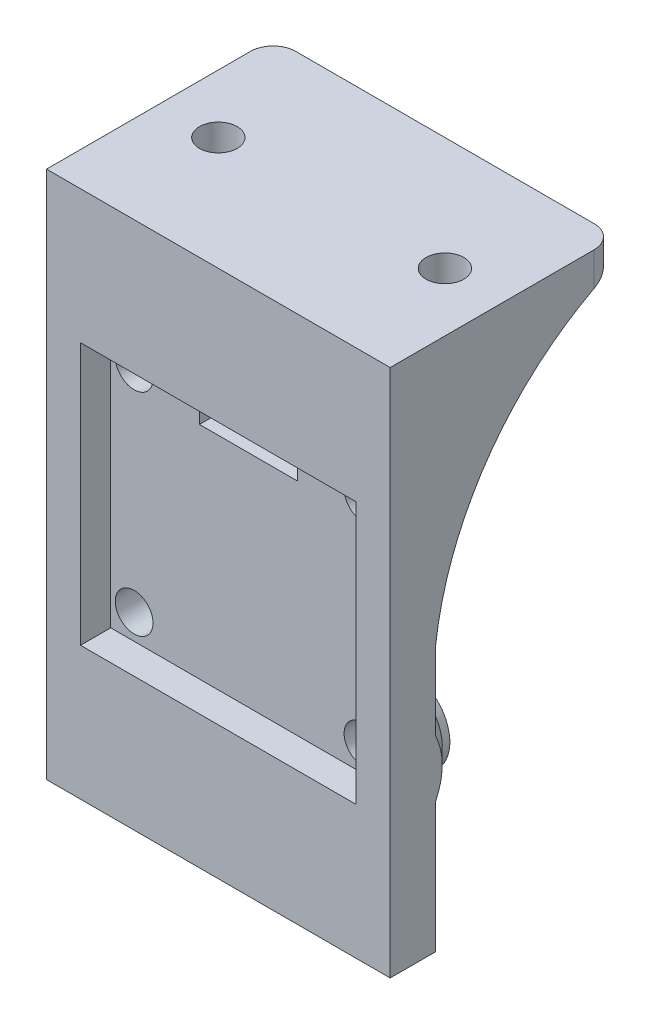
from build123d import *

# Parameters (mm, degrees)
SKETCH1_W                = 45.5
SKETCH1_H                = 70
SKETCH1_R                = 2.5
BOSS_EXTRUDE1_DEPTH      = 6
SKETCH2_W                = 36.5
SKETCH2_H                = 34.7
CUT_EXTRUDE1_DEPTH       = 4
BOSS_EXTRUDE2_DEPTH      = 22.75
BOSS_EXTRUDE2_DEPTH_BACK = 22.75
SKETCH3_W                = 24
SKETCH3_H                = 3
BOSS_EXTRUDE3_DEPTH      = 2
BOSS_EXTRUDE4_START      = -2
BOSS_EXTRUDE4_DEPTH      = 2
SKETCH6_R                = 2.5
CUT_EXTRUDE2_DEPTH       = 6
FILLET1_R                = 3
SKETCH7_R                = 5.5
SKETCH7_R_2              = 2.5
BOSS_EXTRUDE5_DEPTH      = 3
BOSS_EXTRUDE6_START      = 4
SKETCH8_R                = 5.5
SKETCH8_R_2              = 2.5
BOSS_EXTRUDE6_DEPTH      = 4
CHAMFER1_SIZE            = 3
SKETCH10_W               = 13
SKETCH10_H               = 5.5
CUT_EXTRUDE3_DEPTH       = 10
CHAMFER3_SIZE            = 1


with BuildPart() as part:
    # Sketch1 → Boss-Extrude1 (new body)
    with BuildSketch(Plane.XY):
        Rectangle(SKETCH1_W, SKETCH1_H)
        with Locations((-15.15, 14)):
            Circle(SKETCH1_R, mode=Mode.SUBTRACT)
        with Locations((15.15, 14)):
            Circle(SKETCH1_R, mode=Mode.SUBTRACT)
        with Locations((15.15, -14)):
            Circle(SKETCH1_R, mode=Mode.SUBTRACT)
        with Locations((-15.15, -14)):
            Circle(SKETCH1_R, mode=Mode.SUBTRACT)
    extrude(amount=BOSS_EXTRUDE1_DEPTH)

    # Sketch2 → Cut-Extrude1 (cut)
    with BuildSketch(Plane.XY.offset(6)):
        Rectangle(SKETCH2_W, SKETCH2_H)
    extrude(amount=-CUT_EXTRUDE1_DEPTH, mode=Mode.SUBTRACT)

    # Sketch3 → Boss-Extrude2 (add, two sides: drawn at the far end of the back side and taken through both)
    with BuildSketch(Plane(origin=(0, 0, 0), x_dir=(0, 0, -1), z_dir=(1, 0, 0)).offset(-BOSS_EXTRUDE2_DEPTH_BACK)):
        with Locations((12, 33.5)):
            Rectangle(SKETCH3_W, SKETCH3_H)
    extrude(amount=BOSS_EXTRUDE2_DEPTH + BOSS_EXTRUDE2_DEPTH_BACK)

    # Sketch4 → Boss-Extrude3 (add)
    with BuildSketch(Plane.ZY.offset(22.75)):
        with BuildLine():
            Line((-24, 32), (0, 32))
            Line((0, 32), (0, 0))
            ThreePointArc((0, 0), (-7.712812921, 19.215390309), (-24, 32))
        make_face()
    extrude(amount=-BOSS_EXTRUDE3_DEPTH)

    # Sketch5 → Boss-Extrude4 (add)
    with BuildSketch(Plane(origin=(22.75, 0, 0), x_dir=(0, 0, -1), z_dir=(1, 0, 0)).offset(BOSS_EXTRUDE4_START)):
        with BuildLine():
            Line((24, 32), (0, 32))
            Line((0, 32), (0, 0))
            ThreePointArc((0, 0), (7.712812921, 19.215390309), (24, 32))
        make_face()
    extrude(amount=BOSS_EXTRUDE4_DEPTH)

    # Sketch6 → Cut-Extrude2 (cut)
    with BuildSketch(Plane(origin=(0, 35, 0), x_dir=(1, 0, 0), z_dir=(0, 1, 0))):
        with Locations(Location((-15, 9, 0), (0, 0, 270))):
            Circle(SKETCH6_R)
        with Locations(Location((15, 9, 0), (0, 0, 270))):
            Circle(SKETCH6_R)
    extrude(amount=-CUT_EXTRUDE2_DEPTH, mode=Mode.SUBTRACT)

    # Fillet1
    # the kernel refuses this fillet: 3 mm, written as the material it takes off along each edge
    with BuildSketch(Plane(origin=(-22.75, 42.5, -24), x_dir=(0, 0, 1), z_dir=(0, -1, 0))) as fillet1_piece_1:
        with BuildLine():
            CenterArc((FILLET1_R, -FILLET1_R), FILLET1_R, 90, 90)
            Line((0, -FILLET1_R), (0, 0))
            Line((0, 0), (FILLET1_R, 0))
        make_face()
    extrude(amount=18, mode=Mode.SUBTRACT)
    with BuildSketch(Plane(origin=(22.75, 42.5, -24), x_dir=(0, 0, 1), z_dir=(0, -1, 0))) as fillet1_piece_2:
        with BuildLine():
            CenterArc((FILLET1_R, FILLET1_R), FILLET1_R, 180, 90)
            Line((0, FILLET1_R), (0, 0))
            Line((0, 0), (FILLET1_R, 0))
        make_face()
    extrude(amount=18, mode=Mode.SUBTRACT)

    # Sketch7 → Boss-Extrude5 (add)
    # profile 1 of 2: a face of its own
    with BuildSketch(Plane.XZ.offset(-32)):
        with Locations(Location((-15, -9, 0), (0, 0, 90))):
            Circle(SKETCH7_R)
        with Locations(Location((-15, -9, 0), (0, 0, 90))):
            Circle(SKETCH7_R_2, mode=Mode.SUBTRACT)
    # profile 2 of 2: a face of its own
    with BuildSketch(Plane.XZ.offset(-32)):
        with Locations(Location((15, -9, 0), (0, 0, 90))):
            Circle(SKETCH7_R)
        with Locations(Location((15, -9, 0), (0, 0, 90))):
            Circle(SKETCH7_R_2, mode=Mode.SUBTRACT)
    extrude(amount=BOSS_EXTRUDE5_DEPTH)

    # Sketch8 → Boss-Extrude6 (add)
    # profile 1 of 4: a face of its own
    with BuildSketch(Plane(origin=(0, 0, 0), x_dir=(-1, 0, 0), z_dir=(0, 0, -1)).offset(BOSS_EXTRUDE6_START)):
        with Locations((-15.15, 14)):
            Circle(SKETCH8_R)
        with Locations((-15.15, 14)):
            Circle(SKETCH8_R_2, mode=Mode.SUBTRACT)
    # profile 2 of 4: a face of its own
    with BuildSketch(Plane(origin=(0, 0, 0), x_dir=(-1, 0, 0), z_dir=(0, 0, -1)).offset(BOSS_EXTRUDE6_START)):
        with Locations((15.15, 14)):
            Circle(SKETCH8_R)
        with Locations((15.15, 14)):
            Circle(SKETCH8_R_2, mode=Mode.SUBTRACT)
    # profile 3 of 4: a face of its own
    with BuildSketch(Plane(origin=(0, 0, 0), x_dir=(-1, 0, 0), z_dir=(0, 0, -1)).offset(BOSS_EXTRUDE6_START)):
        with Locations((15.15, -14)):
            Circle(SKETCH8_R)
        with Locations((15.15, -14)):
            Circle(SKETCH8_R_2, mode=Mode.SUBTRACT)
    # profile 4 of 4: a face of its own
    with BuildSketch(Plane(origin=(0, 0, 0), x_dir=(-1, 0, 0), z_dir=(0, 0, -1)).offset(BOSS_EXTRUDE6_START)):
        with Locations((-15.15, -14)):
            Circle(SKETCH8_R)
        with Locations((-15.15, -14)):
            Circle(SKETCH8_R_2, mode=Mode.SUBTRACT)
    extrude(amount=-BOSS_EXTRUDE6_DEPTH)

    # Chamfer1
    # the kernel refuses this chamfer: 3 mm, written as the material it adds along each edge
    with BuildSketch(Plane(origin=(15, 32, -9), x_dir=(0, 0, 1), z_dir=(1, 0, 0))) as chamfer1_piece_1_section:
        Polygon((5.5 + CHAMFER1_SIZE, 0), (5.5, CHAMFER1_SIZE), (5.5, 0), align=None)
    chamfer1_piece_1 = revolve(axis=Axis((15, 32, -9), (0, -1, 0)), mode=Mode.PRIVATE)
    chamfer1_piece_1 = split(chamfer1_piece_1, bisect_by=Plane(origin=(20.75, 30.538271309, -15.961728691), z_dir=(-1, 0, 0)), keep=Keep.TOP, mode=Mode.PRIVATE)
    add(chamfer1_piece_1)
    with BuildSketch(Plane(origin=(-15, 32, -9), x_dir=(0, 0, 1), z_dir=(1, 0, 0))) as chamfer1_piece_2_section:
        Polygon((5.5 + CHAMFER1_SIZE, 0), (5.5, CHAMFER1_SIZE), (5.5, 0), align=None)
    chamfer1_piece_2 = revolve(axis=Axis((-15, 32, -9), (0, -1, 0)), mode=Mode.PRIVATE)
    chamfer1_piece_2 = split(chamfer1_piece_2, bisect_by=Plane(origin=(-20.75, 30.538271309, -15.961728691), z_dir=(1, 0, 0)), keep=Keep.TOP, mode=Mode.PRIVATE)
    add(chamfer1_piece_2)
    with BuildSketch(Plane(origin=(15.15, -14, 0), x_dir=(-1, 0, 0), z_dir=(0, -1, 0))) as chamfer1_piece_3_section:
        Polygon((5.5 + CHAMFER1_SIZE, 0), (5.5, CHAMFER1_SIZE), (5.5, 0), align=None)
    chamfer1_piece_3 = revolve(axis=Axis((15.15, -14, 0), (0, 0, -1)), mode=Mode.PRIVATE)
    chamfer1_piece_3 = split(chamfer1_piece_3, bisect_by=Plane(origin=(22.75, -14, -1.459917712), z_dir=(-1, 0, 0)), keep=Keep.TOP, mode=Mode.PRIVATE)
    add(chamfer1_piece_3)
    with BuildSketch(Plane(origin=(-15.15, -14, 0), x_dir=(-1, 0, 0), z_dir=(0, -1, 0))) as chamfer1_piece_4_section:
        Polygon((5.5 + CHAMFER1_SIZE, 0), (5.5, CHAMFER1_SIZE), (5.5, 0), align=None)
    chamfer1_piece_4 = revolve(axis=Axis((-15.15, -14, 0), (0, 0, -1)), mode=Mode.PRIVATE)
    chamfer1_piece_4 = split(chamfer1_piece_4, bisect_by=Plane(origin=(-22.75, -14, -1.459917712), z_dir=(1, 0, 0)), keep=Keep.TOP, mode=Mode.PRIVATE)
    add(chamfer1_piece_4)
    with BuildSketch(Plane(origin=(-15.15, 14, 0), x_dir=(-1, 0, 0), z_dir=(0, -1, 0))) as chamfer1_piece_5_section:
        Polygon((5.5 + CHAMFER1_SIZE, 0), (5.5, CHAMFER1_SIZE), (5.5, 0), align=None)
    chamfer1_piece_5 = revolve(axis=Axis((-15.15, 14, 0), (0, 0, -1)), mode=Mode.PRIVATE)
    chamfer1_piece_5 = split(chamfer1_piece_5, bisect_by=Plane(origin=(-20.75, 14, -1.462006574), z_dir=(1, 0, 0)), keep=Keep.TOP, mode=Mode.PRIVATE)
    add(chamfer1_piece_5)
    with BuildSketch(Plane(origin=(15.15, 14, 0), x_dir=(-1, 0, 0), z_dir=(0, -1, 0))) as chamfer1_piece_6_section:
        Polygon((5.5 + CHAMFER1_SIZE, 0), (5.5, CHAMFER1_SIZE), (5.5, 0), align=None)
    chamfer1_piece_6 = revolve(axis=Axis((15.15, 14, 0), (0, 0, -1)), mode=Mode.PRIVATE)
    chamfer1_piece_6 = split(chamfer1_piece_6, bisect_by=Plane(origin=(20.75, 20.895299958, -0.462006574), z_dir=(-1, 0, 0)), keep=Keep.TOP, mode=Mode.PRIVATE)
    add(chamfer1_piece_6)

    # Sketch10 → Cut-Extrude3 (cut)
    with BuildSketch(Plane.XY.offset(2)):
        with Locations((0, 14.6)):
            Rectangle(SKETCH10_W, SKETCH10_H)
    extrude(amount=-CUT_EXTRUDE3_DEPTH, mode=Mode.SUBTRACT)

    # Chamfer3
    # the kernel refuses this chamfer: 1 mm, written as the material it adds along each edge
    with BuildSketch(Plane(origin=(-20.75, 32, 0), x_dir=(0, -0.9996219169112968, 0.02749587661058639), z_dir=(1, 0, 0))) as chamfer3_piece_1_section:
        Polygon((CHAMFER3_SIZE * 0.999621916911, CHAMFER3_SIZE * 0.0274958766106), (-CHAMFER3_SIZE * 0.0274958766106, CHAMFER3_SIZE * 0.999621916911), (0, 0), align=None)
    chamfer3_piece_1 = extrude(amount=44.071682988, mode=Mode.PRIVATE)
    chamfer3_piece_1 = split(chamfer3_piece_1, bisect_by=Plane(origin=(22.75, 31.661719014, -0.324794748), z_dir=(-1, 0, 0)), keep=Keep.TOP, mode=Mode.PRIVATE)
    add(chamfer3_piece_1)


solid = part.part
